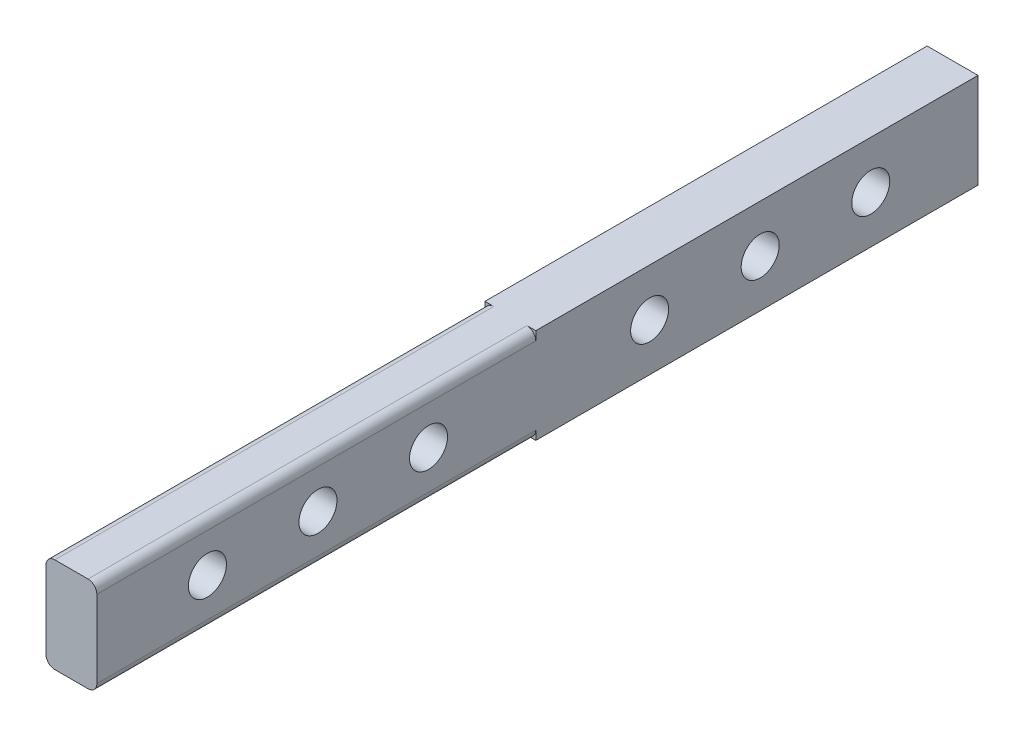
from build123d import *

# Parameters (mm, degrees)
SKETCH_1_W          = 5.75
SKETCH_1_H          = 10.75
EXTRUDE_1_DEPTH     = 49.626419933
FILLET_1_R          = 1
SKETCH_1_2_W        = 5.75
SKETCH_1_2_H        = 10.75
EXTRUDE_2_DEPTH     = 50
SKETCH_2_R          = 2.15
CUT_EXTRUDE_1_DEPTH = 51.615739894


with BuildPart() as part:
    # 草图1 → 凸台-拉伸1 (new body)
    with BuildSketch(Plane.XY):
        Rectangle(SKETCH_1_W, SKETCH_1_H)
    extrude(amount=EXTRUDE_1_DEPTH)

    # 圆角1
    fillet_1_edges = [part.edges().sort_by_distance(p)[0] for p in [
        (2.875, -5.375, 24.813209966),
        (-2.875, -5.375, 24.813209966),
        (-2.875, 5.375, 24.813209966),
        (2.875, 5.375, 24.813209966),
    ]]
    fillet(fillet_1_edges, radius=FILLET_1_R)

    # 草图1<2> → 凸台-拉伸2 (add)
    with BuildSketch(Plane.XY):
        Rectangle(SKETCH_1_2_W, SKETCH_1_2_H)
    extrude(amount=-EXTRUDE_2_DEPTH)

    # 草图2 → 切除-拉伸1 (cut, through all)
    with BuildSketch(Plane(origin=(2.875, 0, 0), x_dir=(0, 0, -1), z_dir=(1, 0, 0))):
        with Locations((-37.126419933, 0)):
            Circle(SKETCH_2_R)
        with Locations((-24.626419933, 0)):
            Circle(SKETCH_2_R)
        with Locations((-12.126419933, 0)):
            Circle(SKETCH_2_R)
        with Locations((12.873580067, 0)):
            Circle(SKETCH_2_R)
        with Locations((25.373580067, 0)):
            Circle(SKETCH_2_R)
        with Locations((37.873580067, 0)):
            Circle(SKETCH_2_R)
    extrude(amount=-CUT_EXTRUDE_1_DEPTH, mode=Mode.SUBTRACT)


solid = part.part
